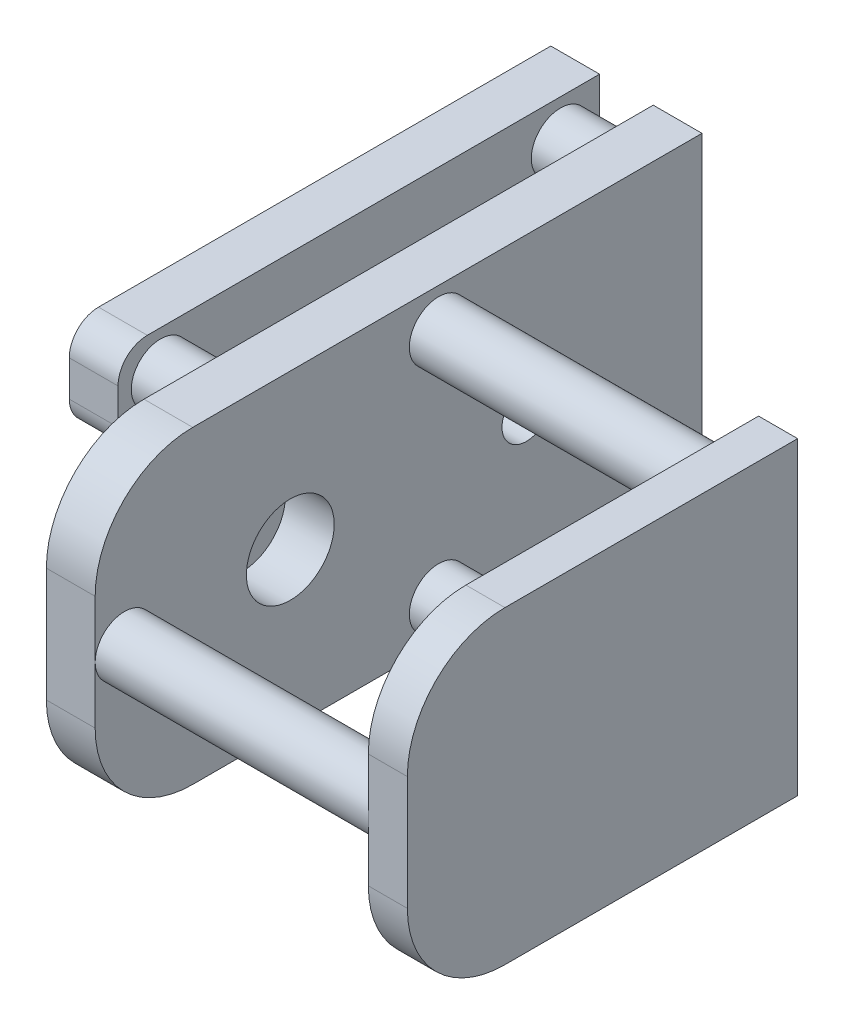
from build123d import *

# Parameters (mm, degrees)
SKETCH_1_R      = 4.5
SKETCH_1_R_2    = 2.5
EXTRUDE_1_DEPTH = 5
SKETCH_2_R      = 3
EXTRUDE_2_DEPTH = 28
EXTRUDE_3_DEPTH = 4
SKETCH_5_R      = 3
EXTRUDE_4_DEPTH = 5.5
EXTRUDE_6_DEPTH = 5


with BuildPart() as part:
    # 草图1 → 凸台-拉伸1 (new body)
    with BuildSketch(Plane(origin=(0, 0, 0), x_dir=(0, 0, -1), z_dir=(1, 0, 0))):
        with BuildLine():
            Line((31.1, -15.85), (-21.1, -15.85))
            ThreePointArc((-21.1, -15.85), (-28.171067812, -12.921067812), (-31.1, -5.85))
            Line((-31.1, -5.85), (-31.1, 5.85))
            ThreePointArc((-31.1, 5.85), (-28.171067812, 12.921067812), (-21.1, 15.85))
            Line((-21.1, 15.85), (31.1, 15.85))
            Line((31.1, 15.85), (31.1, -15.85))
        make_face()
        with Locations((-11.1, 0)):
            Circle(SKETCH_1_R, mode=Mode.SUBTRACT)
        with Locations((13.1, 0)):
            Circle(SKETCH_1_R_2, mode=Mode.SUBTRACT)
    extrude(amount=EXTRUDE_1_DEPTH)

    # 草图2 → 凸台-拉伸2 (add)
    with BuildSketch(Plane(origin=(5, 0, 0), x_dir=(0, 0, -1), z_dir=(1, 0, 0))):
        with Locations((-28.1, 0)):
            Circle(SKETCH_2_R)
        with Locations((4.1, 11.85)):
            Circle(SKETCH_2_R)
        with Locations((4.1, -11.85)):
            Circle(SKETCH_2_R)
    extrude(amount=EXTRUDE_2_DEPTH)

    # 草图3 → 凸台-拉伸3 (add)
    with BuildSketch(Plane(origin=(33, 0, 0), x_dir=(0, 0, -1), z_dir=(1, 0, 0))):
        with BuildLine():
            Line((8.9, 15.85), (-21.1, 15.85))
            ThreePointArc((-21.1, 15.85), (-28.171067812, 12.921067812), (-31.1, 5.85))
            Line((-31.1, 5.85), (-31.1, 0))
            Line((-31.1, 0), (-31.1, -5.85))
            ThreePointArc((-31.1, -5.85), (-28.171067812, -12.921067812), (-21.1, -15.85))
            Line((-21.1, -15.85), (8.9, -15.85))
            Line((8.9, -15.85), (8.9, 15.85))
        make_face()
    extrude(amount=EXTRUDE_3_DEPTH)

    # 草图5 → 凸台-拉伸4 (add)
    with BuildSketch(Plane.ZY):
        with Locations((-27.1, 11.85)):
            Circle(SKETCH_5_R)
        with Locations((-27.1, -11.978090594)):
            Circle(SKETCH_5_R)
        with Locations((13.9, 11.85)):
            Circle(SKETCH_5_R)
        with Locations((13.9, -11.978090594)):
            Circle(SKETCH_5_R)
    extrude(amount=EXTRUDE_4_DEPTH)

    # 草图6 → 凸台-拉伸6 (add)
    with BuildSketch(Plane.ZY.offset(5.5)):
        with BuildLine():
            Line((15.255672946, -15.85), (-31.1, -15.85))
            Line((-31.1, -15.85), (-31.1, 15.85))
            Line((-31.1, 15.85), (15.255672946, 15.85))
            ThreePointArc((15.255672946, 15.85), (17.376993289, 14.971320344), (18.255672946, 12.85))
            Line((18.255672946, 12.85), (18.255672946, 9.183659284))
            ThreePointArc((18.255672946, 9.183659284), (17.376993289, 7.062338941), (15.255672946, 6.183659284))
            Line((15.255672946, 6.183659284), (8.696116264, 6.183659284))
            ThreePointArc((8.696116264, 6.183659284), (6.574795921, 5.304979628), (5.696116264, 3.183659284))
            Line((5.696116264, 3.183659284), (5.696116264, -3.183659284))
            ThreePointArc((5.696116264, -3.183659284), (6.574795921, -5.304979628), (8.696116264, -6.183659284))
            Line((8.696116264, -6.183659284), (15.255672946, -6.183659284))
            ThreePointArc((15.255672946, -6.183659284), (17.376993289, -7.062338941), (18.255672946, -9.183659284))
            Line((18.255672946, -9.183659284), (18.255672946, -12.85))
            ThreePointArc((18.255672946, -12.85), (17.376993289, -14.971320344), (15.255672946, -15.85))
        make_face()
    extrude(amount=EXTRUDE_6_DEPTH)


solid = part.part
